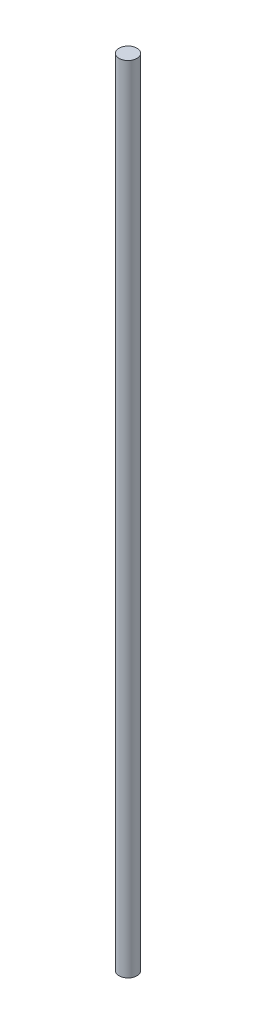
from build123d import *

# Parameters (mm, degrees)
SKETCH1_R           = 5
BOSS_EXTRUDE2_DEPTH = 446


with BuildPart() as part:
    # Sketch1 → Boss-Extrude2 (new body)
    with BuildSketch(Plane(origin=(0, 0, 0), x_dir=(1, 0, 0), z_dir=(0, 1, 0))):
        Circle(SKETCH1_R)
    extrude(amount=BOSS_EXTRUDE2_DEPTH)


solid = part.part
